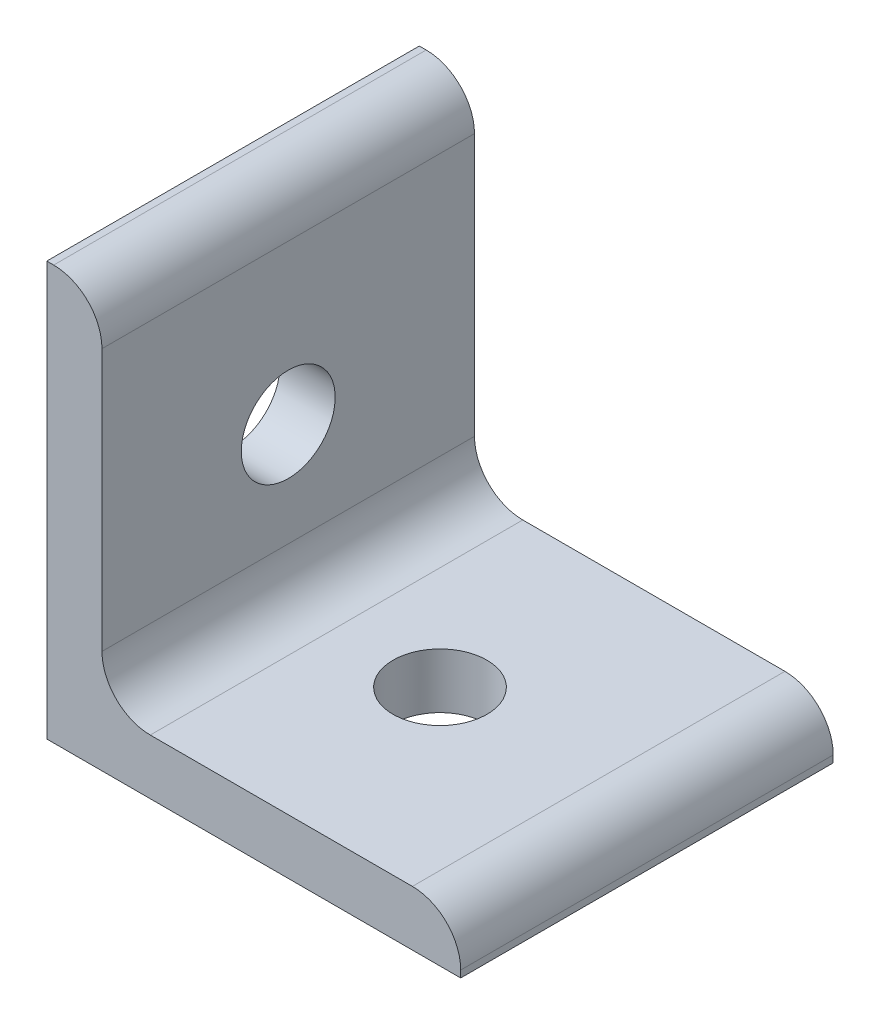
from build123d import *

# Parameters (mm, degrees)
BOSS_EXTRUDE1_DEPTH = 13.5
SKETCH4_R           = 3.4036
CUT_EXTRUDE3_DEPTH  = 10
SKETCH5_R           = 3.4036
CUT_EXTRUDE4_DEPTH  = 10


with BuildPart() as part:
    # Sketch1 → Boss-Extrude1 (new, symmetric)
    with BuildSketch(Plane.XY):
        with BuildLine():
            Line((0, 0), (30, 0))
            Line((30, 0), (30, 0.5))
            ThreePointArc((30, 0.5), (28.974873734, 2.974873734), (26.5, 4))
            Line((26.5, 4), (7.5, 4))
            ThreePointArc((7.5, 4), (5.025126266, 5.025126266), (4, 7.5))
            Line((4, 7.5), (4, 26.5))
            ThreePointArc((4, 26.5), (2.974873734, 28.974873734), (0.5, 30))
            Line((0.5, 30), (0, 30))
            Line((0, 30), (0, 0))
        make_face()
    extrude(amount=BOSS_EXTRUDE1_DEPTH, both=True)

    # Sketch4 → Cut-Extrude3 (cut)
    with BuildSketch(Plane.ZY):
        with Locations((0, 15)):
            Circle(SKETCH4_R)
    extrude(amount=-CUT_EXTRUDE3_DEPTH, mode=Mode.SUBTRACT)

    # Sketch5 → Cut-Extrude4 (cut)
    with BuildSketch(Plane.XZ):
        with Locations((15, 0)):
            Circle(SKETCH5_R)
    extrude(amount=-CUT_EXTRUDE4_DEPTH, mode=Mode.SUBTRACT)


solid = part.part
